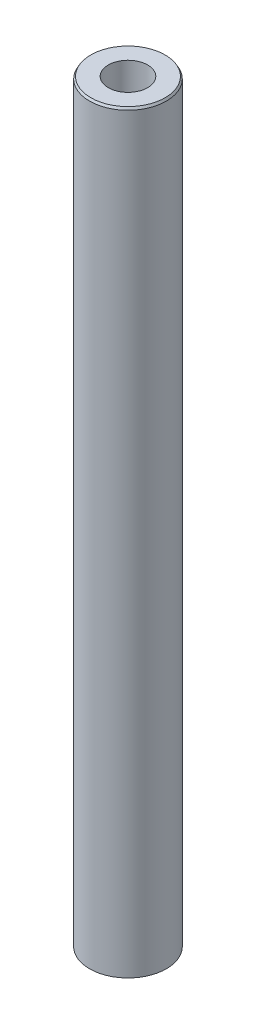
from build123d import *
from OCP.BRepFilletAPI import BRepFilletAPI_MakeChamfer

# Parameters (mm, degrees)
SKETCH1_R           = 7.5
BOSS_EXTRUDE1_DEPTH = 147.362707565
SKETCH2_R           = 3.846325829
CUT_EXTRUDE1_DEPTH  = 148.743925698
CHAMFER1_SIZE       = 0.436710744
CHAMFER1_SIZE2      = 0.252135065


with BuildPart() as part:
    # Sketch1 → Boss-Extrude1 (new body)
    with BuildSketch(Plane(origin=(0, 0, 0), x_dir=(1, 0, 0), z_dir=(0, 1, 0))):
        Circle(SKETCH1_R)
    extrude(amount=BOSS_EXTRUDE1_DEPTH)

    # Sketch2 → Cut-Extrude1 (cut, through all)
    with BuildSketch(Plane(origin=(0, 0, 0), x_dir=(1, 0, 0), z_dir=(0, 1, 0))):
        Circle(SKETCH2_R)
    extrude(amount=CUT_EXTRUDE1_DEPTH, mode=Mode.SUBTRACT)

    # Chamfer1: one chamfer whose edges measure the first distance from different faces: ONE call of the kernel's chamfer builder (chamfer() names one face for all edges)
    chamfer1_edges_1 = [part.edges().sort_by_distance(p)[0] for p in [
        (-7.5, 147.362707565, 0),
    ]]
    chamfer1_side_1 = [part.faces().sort_by_distance(p)[0] for p in [
        (-7.5, 73.681353782, 0),
    ]]
    chamfer1_edges_2 = [part.edges().sort_by_distance(p)[0] for p in [
        (-7.5, 0, 0),
    ]]
    chamfer1_side_2 = [part.faces().sort_by_distance(p)[0] for p in [
        (-7.287867966, 0, 0),
    ]]
    chamfer1 = BRepFilletAPI_MakeChamfer(part.part.solid().wrapped)
    for e in chamfer1_edges_1:
        chamfer1.Add(CHAMFER1_SIZE, CHAMFER1_SIZE2, e.wrapped, chamfer1_side_1[0].wrapped)  # the first distance lies on this face
    for e in chamfer1_edges_2:
        chamfer1.Add(CHAMFER1_SIZE, CHAMFER1_SIZE2, e.wrapped, chamfer1_side_2[0].wrapped)  # the first distance lies on this face
    add(Compound.cast(chamfer1.Shape()), mode=Mode.REPLACE)


solid = part.part
